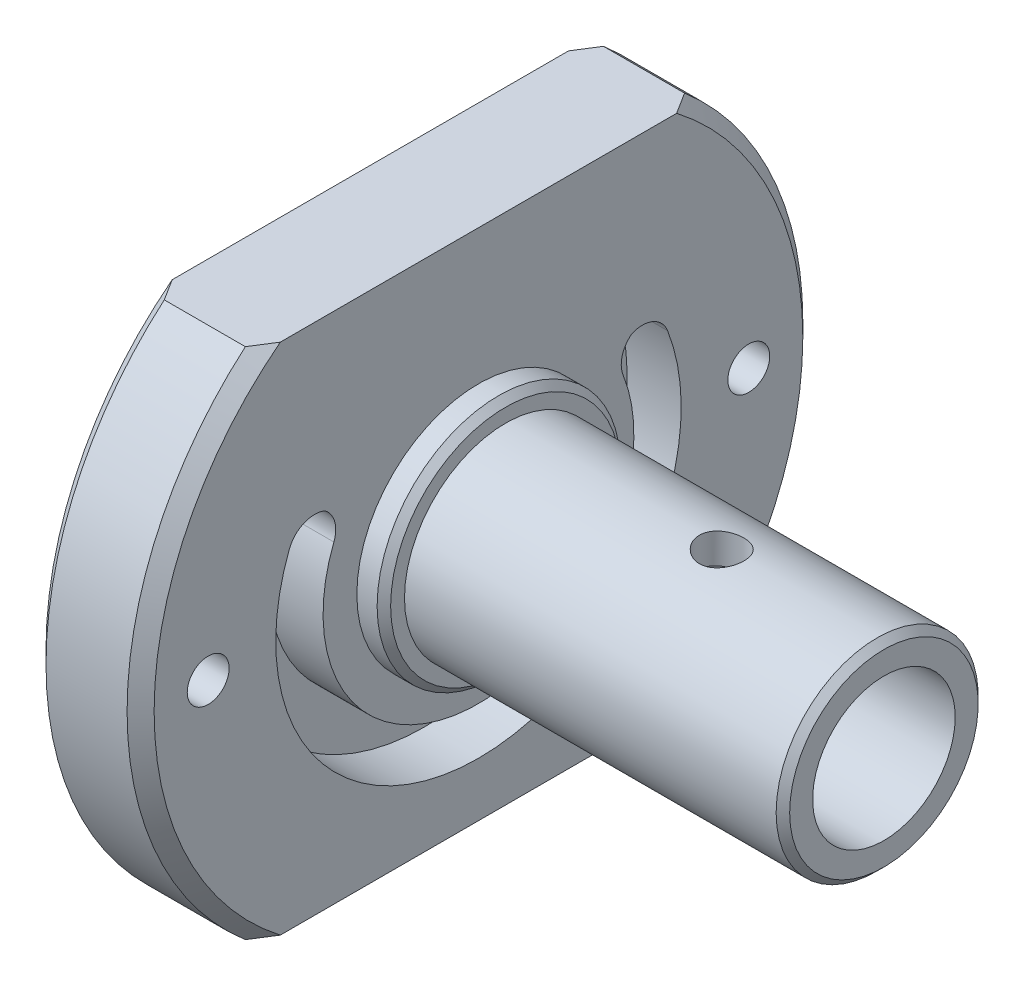
from build123d import *

# Parameters (mm, degrees)
SKETCH_3_R            = 5.275
CUT_EXTRUDE_1_DEPTH   = 15
CHAMFER_1_SIZE        = 0.5
M4_TAPPED_HOLE1_D     = 3.3
M4_TAPPED_HOLE1_DEPTH = 29.5
M4_TAPPED_HOLE1_TIP   = 0.991420021
CHAMFER_2_SIZE        = 1
CHAMFER_3_SIZE        = 1
CHAMFER_5_SIZE        = 0.5
CUT_EXTRUDE_6_DEPTH   = 4
FILLET_3_R            = 2
SKETCH1_R             = 1.55
CUT_EXTRUDE1_DEPTH    = 52.903757163
SKETCH2_R             = 2.55
CUT_EXTRUDE2_DEPTH    = 52.903757163
SKETCH3_R             = 5
CUT_EXTRUDE3_DEPTH    = 18
SKETCH4_W             = 63.526992204
SKETCH4_H             = 10.779144769
CUT_EXTRUDE4_DEPTH    = 10


with BuildPart() as part:
    # 草图1 → 旋转1 (revolve)
    with BuildSketch(Plane(origin=(0, 0, 0), x_dir=(1, 0, 0), z_dir=(0, 1, 0)), mode=Mode.PRIVATE) as revolve_1_sk:
        Polygon((38, 0), (38, 7.475), (10, 7.475), (10, 9), (8, 9), (8, 25), (0, 25), (0, 0), align=None)
    revolve(revolve_1_sk.sketch.rotate(Axis((-70.217520546, 0, 0), (1, 0, 0)), 180), axis=Axis((-70.217520546, 0, 0), (1, 0, 0)))

    # 草图3 → 切除-拉伸1 (cut)
    with BuildSketch(Plane(origin=(38, 0, 0), x_dir=(0, 0, -1), z_dir=(1, 0, 0))):
        Circle(SKETCH_3_R)
    extrude(amount=-CUT_EXTRUDE_1_DEPTH, mode=Mode.SUBTRACT)

    # 倒角1
    chamfer_1_edges = [part.edges().sort_by_distance(p)[0] for p in [
        (38, 0, -7.475),
    ]]
    chamfer(chamfer_1_edges, length=CHAMFER_1_SIZE)

    # M4 Tapped Hole1
    with Locations(Plane(origin=(26, 7.475, 0), x_dir=(0, 0, 1), z_dir=(0, 1, 0))):
        with Locations((0, 0)):
            Hole(M4_TAPPED_HOLE1_D / 2, depth=M4_TAPPED_HOLE1_DEPTH)
            with Locations((0, 0, -(M4_TAPPED_HOLE1_DEPTH + M4_TAPPED_HOLE1_TIP / 2))):  # 118° drill point
                Cone(0, M4_TAPPED_HOLE1_D / 2, M4_TAPPED_HOLE1_TIP, mode=Mode.SUBTRACT)

    # 倒角2
    chamfer_2_edges = [part.edges().sort_by_distance(p)[0] for p in [
        (8, 0, -25),
    ]]
    chamfer(chamfer_2_edges, length=CHAMFER_2_SIZE)

    # 倒角3
    chamfer_3_edges = [part.edges().sort_by_distance(p)[0] for p in [
        (0, 0, -25),
    ]]
    chamfer(chamfer_3_edges, length=CHAMFER_3_SIZE)

    # 倒角5
    chamfer_5_edges = [part.edges().sort_by_distance(p)[0] for p in [
        (10, 0, -9),
    ]]
    chamfer(chamfer_5_edges, length=CHAMFER_5_SIZE)

    # 草图14 → 切除-拉伸6 (cut)
    with BuildSketch(Plane(origin=(8, 0, 0), x_dir=(0, 0, -1), z_dir=(1, 0, 0))):
        with BuildLine():
            Line((9.959292144, 5.75), (12.990381057, 7.5))
            ThreePointArc((12.990381057, 7.5), (0, -15), (-12.990381057, 7.5))
            Line((-12.990381057, 7.5), (-9.959292144, 5.75))
            ThreePointArc((-9.959292144, 5.75), (0, -11.5), (9.959292144, 5.75))
        make_face()
    extrude(amount=-CUT_EXTRUDE_6_DEPTH, mode=Mode.SUBTRACT)

    # 圆角3
    # the kernel refuses this fillet: 2 mm, written as the material it adds along each edge
    with BuildSketch(Plane(origin=(8, 7.5, -12.990381057), x_dir=(0, -0.5000000000000007, 0.866025403784438), z_dir=(-1, 0, 0))) as fillet_3_piece_1_section:
        with BuildLine():
            CenterArc((2.154767421, -2), FILLET_3_R, 90, 98.849883098)
            ThreePointArc((0.178577794, -2.307692308), (0.044711084, -1.15729575), (0, 0))
            Line((0, 0), (2.154767421, 0))
        make_face()
    fillet_3_piece_1 = extrude(amount=9.786478752, mode=Mode.PRIVATE)
    fillet_3_piece_1 = split(fillet_3_piece_1, bisect_by=Plane(origin=(0, 6.79994524, -12.820889695), z_dir=(1, 0, 0)), keep=Keep.TOP, mode=Mode.PRIVATE)
    add(fillet_3_piece_1)
    with BuildSketch(Plane(origin=(8, 5.75, -9.959292144), x_dir=(0, 0.5000000000000014, -0.8660254037844377), z_dir=(-1, 0, 0))) as fillet_3_piece_2_section:
        with BuildLine():
            CenterArc((1.851029923, 2), FILLET_3_R, 188.519624254, 81.480375746)
            ThreePointArc((-0.126900436, 1.703703704), (-0.03176899, 0.854211629), (0, 0))
            Line((0, 0), (1.851029923, 0))
        make_face()
    fillet_3_piece_2 = extrude(amount=8.627574807, mode=Mode.PRIVATE)
    fillet_3_piece_2 = split(fillet_3_piece_2, bisect_by=Plane(origin=(0, 5.623831717, -10.498036137), z_dir=(1, 0, 0)), keep=Keep.TOP, mode=Mode.PRIVATE)
    add(fillet_3_piece_2)
    with BuildSketch(Plane(origin=(8, 5.75, 9.959292144), x_dir=(0, 0.5000000000000036, 0.8660254037844366), z_dir=(-1, 0, 0))) as fillet_3_piece_3_section:
        with BuildLine():
            CenterArc((1.851029923, -2), FILLET_3_R, 90, 81.480375746)
            ThreePointArc((-0.126900436, -1.703703704), (-0.03176899, -0.854211629), (0, 0))
            Line((0, 0), (1.851029923, 0))
        make_face()
    fillet_3_piece_3 = extrude(amount=8.627574807, mode=Mode.PRIVATE)
    fillet_3_piece_3 = split(fillet_3_piece_3, bisect_by=Plane(origin=(0, 5.623831717, 10.498036137), z_dir=(1, 0, 0)), keep=Keep.TOP, mode=Mode.PRIVATE)
    add(fillet_3_piece_3)
    with BuildSketch(Plane(origin=(8, 7.5, 12.990381057), x_dir=(0, -0.9020205331302129, 0.43169312921505554), z_dir=(-1, 0, 0))) as fillet_3_piece_4_section:
        with BuildLine():
            CenterArc((2.160285401, -1.994038522), FILLET_3_R, 85.575058451, 98.849883098)
            Line((0.166246879, -2.148344622), (0, 0))
            ThreePointArc((0, 0), (1.15729575, 0.044711084), (2.314591501, 0))
        make_face()
    fillet_3_piece_4 = extrude(amount=9.786478752, mode=Mode.PRIVATE)
    fillet_3_piece_4 = split(fillet_3_piece_4, bisect_by=Plane(origin=(0, 6.79994524, 12.820889695), z_dir=(1, 0, 0)), keep=Keep.TOP, mode=Mode.PRIVATE)
    add(fillet_3_piece_4)

    # Sketch1 → Cut-Extrude1 (cut, through all)
    with BuildSketch(Plane.ZY):
        with Locations((20, 0)):
            Circle(SKETCH1_R)
        with Locations((-20, 0)):
            Circle(SKETCH1_R)
    extrude(amount=-CUT_EXTRUDE1_DEPTH, mode=Mode.SUBTRACT)

    # Sketch2 → Cut-Extrude2 (cut, through all)
    with BuildSketch(Plane.ZY):
        Circle(SKETCH2_R)
    extrude(amount=-CUT_EXTRUDE2_DEPTH, mode=Mode.SUBTRACT)

    # Sketch3 → Cut-Extrude3 (cut)
    with BuildSketch(Plane.ZY):
        Circle(SKETCH3_R)
    extrude(amount=-CUT_EXTRUDE3_DEPTH, mode=Mode.SUBTRACT)

    # Sketch4 → Cut-Extrude4 (cut)
    with BuildSketch(Plane.ZY):
        with Locations((2.721906885, -24.389572384)):
            Rectangle(SKETCH4_W, SKETCH4_H)
        with Locations((2.721906885, 24.389572384)):
            Rectangle(SKETCH4_W, SKETCH4_H)
    extrude(amount=-CUT_EXTRUDE4_DEPTH, mode=Mode.SUBTRACT)


solid = part.part
